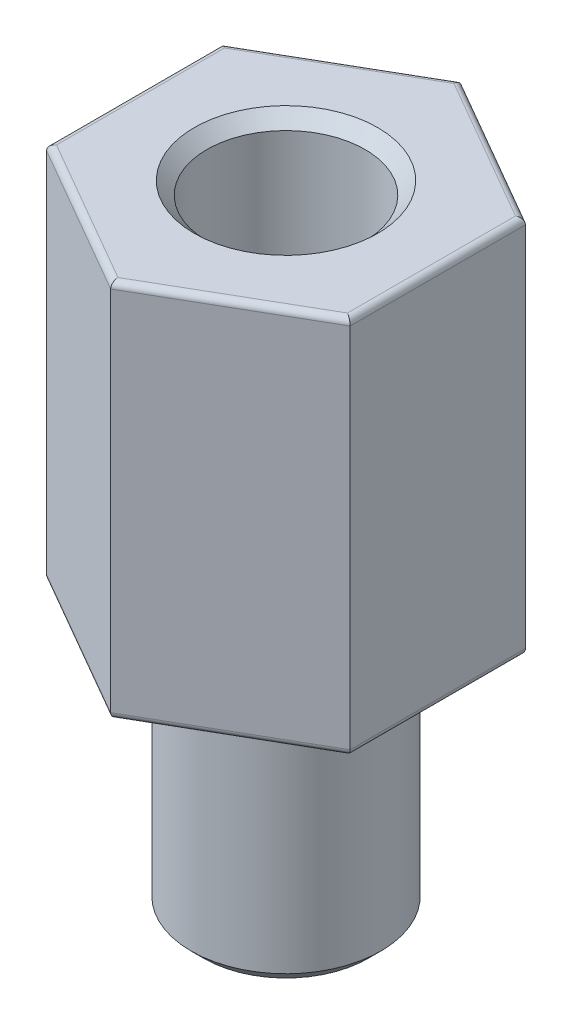
from build123d import *

# Parameters (mm, degrees)
SKETCH_2_R            = 1.5
EXTRUDE_1_DEPTH       = 4
EXTRUDE_2_DEPTH       = 6
FILLET_1_R            = 0.1
HOLE_WIZARD_M31_D     = 2.5
HOLE_WIZARD_M31_DEPTH = 5
HOLE_WIZARD_M31_TIP   = 0.751075774
CHAMFER_2_SIZE        = 0.2


with BuildPart() as part:
    # Эскиз2 → Бобышка-Вытянуть1 (new body)
    with BuildSketch(Plane(origin=(0, 0, 0), x_dir=(1, 0, 0), z_dir=(0, 1, 0))):
        Circle(SKETCH_2_R)
    extrude(amount=EXTRUDE_1_DEPTH)

    # Эскиз3 → Бобышка-Вытянуть2 (add)
    with BuildSketch(Plane(origin=(0, 4, 0), x_dir=(1, 0, 0), z_dir=(0, 1, 0))):
        Polygon((-2.4, 1.385640646), (-2.4, -1.385640646), (0, -2.771281292), (2.4, -1.385640646), (2.4, 1.385640646), (0, 2.771281292), align=None)
    extrude(amount=EXTRUDE_2_DEPTH)

    # Скругление1
    fillet_1_edges = [part.edges().sort_by_distance(p)[0] for p in [
        (2.4, 4, 0),
        (1.2, 4, 2.078460969),
        (-1.2, 4, 2.078460969),
        (-2.4, 4, 0),
        (-1.2, 4, -2.078460969),
        (1.2, 4, -2.078460969),
        (-1.2, 10, -2.078460969),
        (-2.4, 10, 0),
        (-1.2, 10, 2.078460969),
        (1.2, 10, 2.078460969),
        (2.4, 10, 0),
        (1.2, 10, -2.078460969),
    ]]
    fillet(fillet_1_edges, radius=FILLET_1_R)

    # Отверстие обработанное метчиком M31
    with Locations(Plane.ZX.offset(10)):
        with Locations((0, 0)):
            Hole(HOLE_WIZARD_M31_D / 2, depth=HOLE_WIZARD_M31_DEPTH)
            with Locations((0, 0, -(HOLE_WIZARD_M31_DEPTH + HOLE_WIZARD_M31_TIP / 2))):  # 118° drill point
                Cone(0, HOLE_WIZARD_M31_D / 2, HOLE_WIZARD_M31_TIP, mode=Mode.SUBTRACT)

    # Фаска2
    chamfer_2_edges = [part.edges().sort_by_distance(p)[0] for p in [
        (-1.5, 0, 0),
        (0, 10, 1.25),
    ]]
    chamfer(chamfer_2_edges, length=CHAMFER_2_SIZE)


solid = part.part
